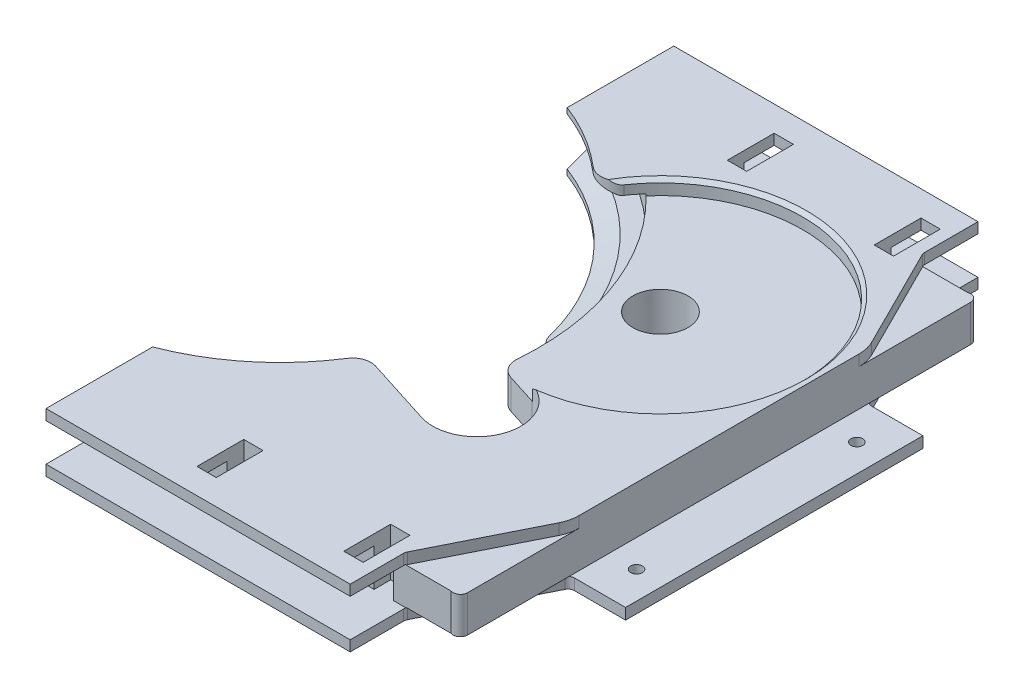
from build123d import *
from build123d.topology import SkipClean

# Parameters (mm, degrees)
EXTRUDE_1_DEPTH         = 4.5
FILLET_START            = -5
FILLET_1_DEPTH          = 10
EXTRUDE_2_DEPTH         = 0.5
EXTRUDE_3_DEPTH         = 3
CHAMFER_1_SIZE          = 5
CHAMFER_1_SIZE_2        = 2
CHAMFER_2_SIZE          = 5
CHAMFER_2_SIZE_2        = 2
SKETCH_5_R              = 7.5
SKETCH_5_R_2            = 9.5
CUT_EXTRUDE_1_DEPTH     = 30
SKETCH_6_R              = 38.75
CUT_EXTRUDE_2_DEPTH     = 4
CHAMFER_3_SIZE          = 1
SKETCH_7_R              = 38.75
CUT_EXTRUDE_3_DEPTH     = 4
CHAMFER_4_SIZE          = 1
FILLET_5_R              = 5
CUT_EXTRUDE_START       = -3
SKETCH_9_W              = 5
SKETCH_9_H              = 12.5
CUT_EXTRUDE_4_DEPTH     = 3
SKETCH_10_W             = 5
SKETCH_10_H             = 4.522155871
CUT_EXTRUDE_5_DEPTH     = 10
CUT_EXTRUDE_6_DEPTH     = 3
FILLET_6_R              = 10
SKETCH_12_R             = 1.6
CUT_EXTRUDE_7_DEPTH     = 10
MOVE_START              = -5.125
MOVE_FACE_1_DEPTH       = 10.25
MOVE_START_2            = 31.473684174
MOVE_FACE_2_DEPTH       = 5.25
MOVE_START_3            = 71.473684174
MOVE_FACE_2_2_DEPTH     = 5.25
CUT_EXTRUDE_START_2     = -13
CUT_EXTRUDE_8_OUTLINE_R = 9.5
CUT_EXTRUDE_8_DEPTH     = 13
FILLET_8_R              = 5
FILLET_9_R              = 5


with BuildPart() as part:
    # ｽｹｯﾁ2 → ﾎﾞｽ - 押し出し1 (new, symmetric)
    with BuildSketch(Plane(origin=(0, 0, 0), x_dir=(1, 0, 0), z_dir=(0, 1, 0))):
        with BuildLine():
            Line((95.1, 70.5), (-24.5, 70.5))
            ThreePointArc((-24.5, 70.5), (25.351028074, 49.851028074), (46, 0))
            ThreePointArc((46, 0), (25.351028074, -49.851028074), (-24.5, -70.5))
            Line((-24.5, -70.5), (95.1, -70.5))
            Line((95.1, -70.5), (95.1, 70.5))
        make_face()
    extrude(amount=EXTRUDE_1_DEPTH, both=True)

    # ﾌｨﾚｯﾄ1: read off the stored shape, not the designer's step
    # ﾌｨﾚｯﾄ1 outline → ﾌｨﾚｯﾄ1 (cut)
    with BuildSketch(Plane(origin=(0, 0, 0), x_dir=(1, 0, 0), z_dir=(0, 1, 0)).offset(FILLET_START)):
        with BuildLine():
            Line((95.1, 70.5), (93.1, 70.5))
            ThreePointArc((93.1, 70.5), (94.514213562, 69.914213562), (95.1, 68.5))
            Line((95.1, 68.5), (95.1, 70.5))
        make_face()
        with BuildLine():
            ThreePointArc((-1.406451941, 66.610344828), (-2.723536699, 68.83218192), (-0.751315826, 70.5))
            Line((-0.751315826, 70.5), (-24.5, 70.5))
            ThreePointArc((-24.5, 70.5), (-12.790587341, 69.520785778), (-1.406451941, 66.610344828))
        make_face()
        with BuildLine():
            Line((95.1, -70.5), (95.1, -68.5))
            ThreePointArc((95.1, -68.5), (94.514213562, -69.914213562), (93.1, -70.5))
            Line((93.1, -70.5), (95.1, -70.5))
        make_face()
        with BuildLine():
            ThreePointArc((-0.751315826, -70.5), (-2.723536699, -68.83218192), (-1.406451941, -66.610344828))
            ThreePointArc((-1.406451941, -66.610344828), (-12.790587341, -69.520785778), (-24.5, -70.5))
            Line((-24.5, -70.5), (-0.751315826, -70.5))
        make_face()
    extrude(amount=FILLET_1_DEPTH, mode=Mode.SUBTRACT)

    # ｽｹｯﾁ3 → ﾎﾞｽ - 押し出し2 (add)
    with BuildSketch(Plane(origin=(0, 4.5, 0), x_dir=(1, 0, 0), z_dir=(0, 1, 0))):
        with BuildLine():
            Line((-2.751315826, -56.455688258), (-2.751315826, -68.5))
            ThreePointArc((-2.751315826, -68.5), (-2.165529388, -69.914213562), (-0.751315826, -70.5))
            Line((-0.751315826, -70.5), (93.1, -70.5))
            ThreePointArc((93.1, -70.5), (94.514213562, -69.914213562), (95.1, -68.5))
            Line((95.1, -68.5), (95.1, 68.5))
            ThreePointArc((95.1, 68.5), (94.514213562, 69.914213562), (93.1, 70.5))
            Line((93.1, 70.5), (-0.751315826, 70.5))
            ThreePointArc((-0.751315826, 70.5), (-2.165529388, 69.914213562), (-2.751315826, 68.5))
            Line((-2.751315826, 68.5), (-2.751315826, 56.455688258))
            ThreePointArc((-2.751315826, 56.455688258), (36, 0), (-2.751315826, -56.455688258))
        make_face()
    extrude_2 = extrude(amount=EXTRUDE_2_DEPTH)

    # ｽｹｯﾁ4 → ﾎﾞｽ - 押し出し3 (add)
    with BuildSketch(Plane(origin=(0, 5, 0), x_dir=(1, 0, 0), z_dir=(0, 1, 0))):
        with BuildLine():
            Line((80.1, 85.5), (-2.751315826, 85.5))
            Line((-2.751315826, 85.5), (-2.751315826, 56.455688258))
            ThreePointArc((-2.751315826, 56.455688258), (36, 0), (-2.751315826, -56.455688258))
            Line((-2.751315826, -56.455688258), (-2.751315826, -85.5))
            Line((-2.751315826, -85.5), (80.1, -85.5))
            Line((80.1, -85.5), (80.1, -70.913118961))
            ThreePointArc((80.1, -70.913118961), (80.146814268, -70.51105135), (80.284752416, -70.130495168))
            Line((80.284752416, -70.130495168), (94.616311896, -41.467376208))
            ThreePointArc((94.616311896, -41.467376208), (95.261530034, -40.761361085), (96.18155948, -40.5))
            Line((96.18155948, -40.5), (110.1, -40.5))
            Line((110.1, -40.5), (110.1, 40.5))
            Line((110.1, 40.5), (96.18155948, 40.5))
            ThreePointArc((96.18155948, 40.5), (95.261530034, 40.761361085), (94.616311896, 41.467376208))
            Line((94.616311896, 41.467376208), (80.284752416, 70.130495168))
            ThreePointArc((80.284752416, 70.130495168), (80.146814268, 70.51105135), (80.1, 70.913118961))
            Line((80.1, 70.913118961), (80.1, 85.5))
        make_face()
    extrude_3 = extrude(amount=EXTRUDE_3_DEPTH)

    # ﾐﾗｰ1: ﾎﾞｽ - 押し出し2, ﾎﾞｽ - 押し出し3 across plane
    add(extrude_2.mirror(Plane.ZX))
    add(extrude_3.mirror(Plane.ZX))

    # 面取り1
    # the kernel refuses this chamfer: 5, 2 mm, written as the material it takes off along each edge
    with BuildSketch(Plane(origin=(-24.5, 4.5, 0), x_dir=(0.15260552545264225, 0, -0.9882871817449232), z_dir=(-0.9882871817449232, 0, -0.15260552545264225))) as chamfer_1_piece_1:
        Polygon((60.5 + CHAMFER_1_SIZE, 0), (60.5, -CHAMFER_1_SIZE_2), (60.5, 0), align=None)
    revolve(axis=Axis((-24.5, 4.5, 0), (0, -1, 0)), revolution_arc=162.444098221, mode=Mode.SUBTRACT)

    # 面取り2
    # the kernel refuses this chamfer: 5, 2 mm, written as the material it takes off along each edge
    with BuildSketch(Plane(origin=(-24.5, -4.5, 0), x_dir=(0.15260552545264225, 0, -0.9882871817449232), z_dir=(-0.9882871817449232, 0, -0.15260552545264225))) as chamfer_2_piece_1:
        Polygon((60.5 + CHAMFER_2_SIZE, 0), (60.5, CHAMFER_2_SIZE_2), (60.5, 0), align=None)
    revolve(axis=Axis((-24.5, -4.5, 0), (0, -1, 0)), revolution_arc=162.444098221, mode=Mode.SUBTRACT)

    # ｽｹｯﾁ5 → ｶｯﾄ - 押し出し1 (cut)
    with BuildSketch(Plane(origin=(0, 8, 0), x_dir=(1, 0, 0), z_dir=(0, 1, 0))):
        with Locations(Location((54.1, 25, 0), (0, 0, 270))):
            Circle(SKETCH_5_R)
        with Locations(Location((54.1, -25, 0), (0, 0, 270))):
            Circle(SKETCH_5_R_2)
    extrude(amount=-CUT_EXTRUDE_1_DEPTH, mode=Mode.SUBTRACT)

    # ｽｹｯﾁ6 → ｶｯﾄ - 押し出し2 (cut)
    with BuildSketch(Plane(origin=(0, 8, 0), x_dir=(1, 0, 0), z_dir=(0, 1, 0))):
        with Locations((54.1, 25)):
            Circle(SKETCH_6_R)
    extrude(amount=-CUT_EXTRUDE_2_DEPTH, mode=Mode.SUBTRACT)

    # 面取り3
    chamfer_3_edges = [part.edges().sort_by_distance(p)[0] for p in [
        (62.737010908, 8, -62.775184216),
    ]]
    chamfer(chamfer_3_edges, length=CHAMFER_3_SIZE)

    # ｽｹｯﾁ7 → ｶｯﾄ - 押し出し3 (cut)
    with BuildSketch(Plane.XZ.offset(8)):
        with Locations((54.1, 25)):
            Circle(SKETCH_7_R)
    extrude(amount=-CUT_EXTRUDE_3_DEPTH, mode=Mode.SUBTRACT)

    # 面取り4
    chamfer_4_edges = [part.edges().sort_by_distance(p)[0] for p in [
        (62.737010908, -8, 62.775184216),
    ]]
    chamfer(chamfer_4_edges, length=CHAMFER_4_SIZE)

    # ﾌｨﾚｯﾄ5
    # the kernel refuses this fillet: 5 mm, written as the material it takes off along each edge
    with BuildSketch(Plane(origin=(35.340814026, 22.117083115, 8.906569299), x_dir=(-0.19646141095302042, 0, 0.9805115573038129), z_dir=(0, -1, 0))) as fillet_5_piece_1:
        with BuildLine():
            CenterArc((6.296702388, -4.993752638), FILLET_5_R, 92.864482588, 95.995664977)
            ThreePointArc((1.356366206, -5.763868475), (0.788439893, -2.855988367), (0, 0))
            ThreePointArc((0, 0), (3.023416623, -0.075593078), (6.046833246, 0))
        make_face()
    extrude(amount=30.734166229, mode=Mode.SUBTRACT)
    with BuildSketch(Plane(origin=(19.200217157, 22.117083115, -41.839467258), x_dir=(-0.72679433316816, 0, -0.6868551501405878), z_dir=(0, -1, 0))) as fillet_5_piece_2_section:
        with BuildLine():
            CenterArc((6.296702388, 4.993752638), FILLET_5_R, 171.139852436, 95.995664977)
            ThreePointArc((1.356366206, 5.763868475), (0.788439893, 2.855988367), (0, 0))
            ThreePointArc((0, 0), (3.023416623, 0.075593078), (6.046833246, 0))
        make_face()
    fillet_5_piece_2 = extrude(amount=30.734166229, mode=Mode.PRIVATE)
    fillet_5_piece_2 = split(fillet_5_piece_2, bisect_by=Plane(origin=(19.200217157, -4.5, -41.839467258), z_dir=(0, 1, 0)), keep=Keep.TOP, mode=Mode.PRIVATE)
    add(fillet_5_piece_2, mode=Mode.SUBTRACT)
    with BuildSketch(Plane(origin=(19.200217157, -22.117083115, 41.839467258), x_dir=(0.5021090947020985, 0, 0.8648042882741962), z_dir=(0, 1, 0))) as fillet_5_piece_3_section:
        with BuildLine():
            CenterArc((6.303329727, -4.985384713), FILLET_5_R, 94.381896893, 95.995664977)
            ThreePointArc((1.385119276, -5.886054442), (0.766142777, -2.925711475), (0, 0))
            ThreePointArc((0, 0), (2.960654872, -0.113268478), (5.921309743, 0))
        make_face()
    fillet_5_piece_3 = extrude(amount=30.734166229, mode=Mode.PRIVATE)
    fillet_5_piece_3 = split(fillet_5_piece_3, bisect_by=Plane(origin=(19.200217157, -4.5, 41.839467258), z_dir=(0, -1, 0)), keep=Keep.TOP, mode=Mode.PRIVATE)
    add(fillet_5_piece_3, mode=Mode.SUBTRACT)
    with BuildSketch(Plane(origin=(35.340814026, -22.117083115, -8.906569299), x_dir=(0.9094383285267518, 0, -0.41583882287067403), z_dir=(0, 1, 0))) as fillet_5_piece_4:
        with BuildLine():
            CenterArc((6.303329727, 4.985384713), FILLET_5_R, 169.62243813, 95.995664977)
            ThreePointArc((1.385119276, 5.886054442), (0.766142777, 2.925711475), (0, 0))
            ThreePointArc((0, 0), (2.960654872, 0.113268478), (5.921309743, 0))
        make_face()
    extrude(amount=30.734166229, mode=Mode.SUBTRACT)

    # ｽｹｯﾁ9 → ｶｯﾄ - 押し出し4 (cut)
    with BuildSketch(Plane(origin=(0, 8, 0), x_dir=(1, 0, 0), z_dir=(0, 1, 0)).offset(CUT_EXTRUDE_START)):
        with Locations((34.098684174, 72.227844129)):
            Rectangle(SKETCH_9_W, SKETCH_9_H)
        with Locations((74.098684174, 72.227844129)):
            Rectangle(SKETCH_9_W, SKETCH_9_H)
    cut_extrude_4 = extrude(amount=CUT_EXTRUDE_4_DEPTH, mode=Mode.SUBTRACT)

    # ｽｹｯﾁ10 → ｶｯﾄ - 押し出し5 (cut)
    with BuildSketch(Plane(origin=(0, 5, 0), x_dir=(1, 0, 0), z_dir=(0, 1, 0))):
        with Locations((34.098684174, 68.238922065)):
            Rectangle(SKETCH_10_W, SKETCH_10_H)
        with Locations((74.098684174, 68.238922065)):
            Rectangle(SKETCH_10_W, SKETCH_10_H)
    cut_extrude_5 = extrude(amount=-CUT_EXTRUDE_5_DEPTH, mode=Mode.SUBTRACT)

    # ﾐﾗｰ2: ｶｯﾄ - 押し出し4, ｶｯﾄ - 押し出し5 across plane
    add(cut_extrude_4.mirror(Plane.XY), mode=Mode.SUBTRACT)
    add(cut_extrude_5.mirror(Plane.XY), mode=Mode.SUBTRACT)

    # ｽｹｯﾁ11 → ｶｯﾄ - 押し出し6 (cut)
    with BuildSketch(Plane(origin=(0, 8, 0), x_dir=(1, 0, 0), z_dir=(0, 1, 0))):
        with BuildLine():
            Line((95.1, 40.5), (95.1, -40.5))
            Line((95.1, -40.5), (95.1, -40.874235089))
            ThreePointArc((95.1, -40.874235089), (95.609322027, -40.596203067), (96.18155948, -40.5))
            Line((96.18155948, -40.5), (110.1, -40.5))
            Line((110.1, -40.5), (110.1, 40.5))
            Line((110.1, 40.5), (96.18155948, 40.5))
            ThreePointArc((96.18155948, 40.5), (95.609322027, 40.596203067), (95.1, 40.874235089))
            Line((95.1, 40.874235089), (95.1, 40.5))
        make_face()
    extrude(amount=-CUT_EXTRUDE_6_DEPTH, mode=Mode.SUBTRACT)

    # ﾌｨﾚｯﾄ6
    # the kernel refuses this fillet: 10 mm, written as the material it takes off along each edge
    with BuildSketch(Plane(origin=(95.1, 14.83728716, -40.874235089), x_dir=(-0.5193327403679237, 0, -0.8545721179525709), z_dir=(0, -1, 0))) as fillet_6_piece_1:
        with BuildLine():
            CenterArc((2.856145416, -9.96605201), FILLET_6_R, 94.7224525, 26.565051177)
            Line((-2.337181988, -1.420330831), (-2.856514728, -0.565758713))
            Line((-2.856514728, -0.565758713), (-0.51933274, 0.854572118))
            Line((-0.51933274, 0.854572118), (0.350857763, 0.936428764))
            ThreePointArc((0.350857763, 0.936428764), (0.675747876, 0.891296436), (1.950525815, 0.996605201))
            Line((1.950525815, 0.996605201), (2.032854869, 0))
        make_face()
    extrude(amount=9.83728716, mode=Mode.SUBTRACT)
    with BuildSketch(Plane(origin=(95.1, 14.83728716, 40.874235089), x_dir=(0, 0, -1), z_dir=(0, -1, 0))) as fillet_6_piece_2:
        with BuildLine():
            CenterArc((2.734914864, -10), FILLET_6_R, 90, 26.565051177)
            Line((-1.737221091, -1.05572809), (-2.184434687, -0.161300899))
            ThreePointArc((-2.184434687, -0.161300899), (-1.040354714, 0.410739087), (-0.786151378, 0.618033989))
            Line((-0.786151378, 0.618033989), (0, 1))
            Line((0, 1), (2.734914864, 1))
            Line((2.734914864, 1), (2.734914864, 0))
        make_face()
    extrude(amount=9.83728716, mode=Mode.SUBTRACT)

    # ｽｹｯﾁ12 → ｶｯﾄ - 押し出し7 (cut)
    with BuildSketch(Plane.XZ.offset(8)):
        with Locations(Location((102.6, 30, 0), (0, 0, 270))):
            Circle(SKETCH_12_R)
        with Locations(Location((102.6, -30, 0), (0, 0, 270))):
            Circle(SKETCH_12_R)
    extrude(amount=-CUT_EXTRUDE_7_DEPTH, mode=Mode.SUBTRACT)

    # Move Face 1: read off the stored shape, not the designer's step
    # Move Face 1 outline → Move Face 1 (cut)
    with SkipClean():  # the faces are left unmerged after this step: merging them gives an invalid solid
        with BuildSketch(Plane(origin=(0, 0, 0), x_dir=(1, 0, 0), z_dir=(0, 1, 0)).offset(MOVE_START)):
            with BuildLine():
                Line((71.598684174, -70.375), (36.598684174, -70.375))
                Line((36.598684174, -70.375), (36.598684174, -65.977844129))
                Line((36.598684174, -65.977844129), (31.598684174, -65.977844129))
                Line((31.598684174, -65.977844129), (31.598684174, -70.375))
                Line((31.598684174, -70.375), (-0.055345281, -70.375))
                ThreePointArc((-0.055345281, -70.375), (-1.893256917, -70.141941091), (-2.751315826, -68.5))
                Line((-2.751315826, -68.5), (-2.751315826, -85.5))
                Line((-2.751315826, -85.5), (80.1, -85.5))
                Line((80.1, -85.5), (80.1, -70.913118961))
                ThreePointArc((80.1, -70.913118961), (80.112409259, -70.705084306), (80.149461048, -70.5))
                Line((80.149461048, -70.5), (93.1, -70.5))
                ThreePointArc((93.1, -70.5), (92.74644661, -70.468501969), (92.404029455, -70.375))
                Line((92.404029455, -70.375), (76.598684174, -70.375))
                Line((76.598684174, -70.375), (76.598684174, -65.977844129))
                Line((76.598684174, -65.977844129), (71.598684174, -65.977844129))
                Line((71.598684174, -65.977844129), (71.598684174, -70.375))
            make_face()
            with BuildLine():
                Line((36.598684174, 70.375), (71.598684174, 70.375))
                Line((71.598684174, 70.375), (71.598684174, 65.977844129))
                Line((71.598684174, 65.977844129), (76.598684174, 65.977844129))
                Line((76.598684174, 65.977844129), (76.598684174, 70.375))
                Line((76.598684174, 70.375), (92.404029455, 70.375))
                ThreePointArc((92.404029455, 70.375), (92.74644661, 70.468501969), (93.1, 70.5))
                Line((93.1, 70.5), (80.149461048, 70.5))
                ThreePointArc((80.149461048, 70.5), (80.112409259, 70.705084306), (80.1, 70.913118961))
                Line((80.1, 70.913118961), (80.1, 85.5))
                Line((80.1, 85.5), (-2.751315826, 85.5))
                Line((-2.751315826, 85.5), (-2.751315826, 68.500000008))
                ThreePointArc((-2.751315826, 68.500000008), (-1.893256914, 70.141941093), (-0.055345281, 70.375))
                Line((-0.055345281, 70.375), (31.598684174, 70.375))
                Line((31.598684174, 70.375), (31.598684174, 65.977844129))
                Line((31.598684174, 65.977844129), (36.598684174, 65.977844129))
                Line((36.598684174, 65.977844129), (36.598684174, 70.375))
            make_face()
        extrude(amount=MOVE_FACE_1_DEPTH, mode=Mode.SUBTRACT)

    # Move Face 2: read off the stored shape, not the designer's step
    # Move Face 2 outline → Move Face 2 (cut)
    with SkipClean():  # the faces are left unmerged after this step: merging them gives an invalid solid
        with BuildSketch(Plane.YZ.offset(MOVE_START_2)):
            Polygon((8, -65.852844129), (-5.125, -65.852844129), (-5.125, -70.375), (5.125, -70.375), (5.125, -78.602844129), (8, -78.602844129), align=None)
            Polygon((-5.125, 65.852844129), (8, 65.852844129), (8, 78.602844129), (5.125, 78.602844129), (5.125, 70.375), (-5.125, 70.375), align=None)
        extrude(amount=MOVE_FACE_2_DEPTH, mode=Mode.SUBTRACT)

    # Move Face 2 2 outline → Move Face 2 2 (cut)
    with SkipClean():  # the faces are left unmerged after this step: merging them gives an invalid solid
        with BuildSketch(Plane.YZ.offset(MOVE_START_3)):
            Polygon((8, -65.852844129), (-5.125, -65.852844129), (-5.125, -70.375), (5.125, -70.375), (5.125, -78.602844129), (8, -78.602844129), align=None)
            Polygon((-5.125, 65.852844129), (8, 65.852844129), (8, 78.602844129), (5.125, 78.602844129), (5.125, 70.375), (-5.125, 70.375), align=None)
        extrude(amount=MOVE_FACE_2_2_DEPTH, mode=Mode.SUBTRACT)

    # ｶｯﾄ - 押し出し8: read off the stored shape, not the designer's step
    # ｶｯﾄ - 押し出し8 outline → ｶｯﾄ - 押し出し8 (cut)
    with SkipClean():  # the faces are left unmerged after this step: merging them gives an invalid solid
        with BuildSketch(Plane(origin=(0, 8, 0), x_dir=(1, 0, 0), z_dir=(0, 1, 0)).offset(CUT_EXTRUDE_START_2)):
            with BuildLine():
                ThreePointArc((34.152844635, -14.835559181), (31.736106848, -22.310317939), (28.371215625, -29.408919707))
                Line((28.371215625, -29.408919707), (50.462757174, -36.435491446))
                ThreePointArc((50.462757174, -36.435491446), (65.535491446, -28.637242826), (57.737242826, -13.564508554))
                Line((57.737242826, -13.564508554), (45.340368533, -9.621482379))
                ThreePointArc((45.340368533, -9.621482379), (45.116001345, -11.129346643), (44.859083026, -12.632007035))
                ThreePointArc((44.859083026, -12.632007035), (42.774857782, -12.058111848), (40.725880062, -11.368879772))
                ThreePointArc((40.725880062, -11.368879772), (36.667669076, -11.639042003), (34.152844635, -14.835559181))
            make_face()
            with Locations((54.1, -25)):
                Circle(CUT_EXTRUDE_8_OUTLINE_R, mode=Mode.SUBTRACT)
        extrude(amount=CUT_EXTRUDE_8_DEPTH, mode=Mode.SUBTRACT)

    # ﾌｨﾚｯﾄ8
    fillet_8_edges = [part.edges().sort_by_distance(p)[0] for p in [
        (38.06588288, 0.25, 32.492465271),
        (45.340368533, 0, 9.621482379),
    ]]
    fillet(fillet_8_edges, radius=FILLET_8_R)

    # ﾌｨﾚｯﾄ9
    fillet_9_edges = [part.edges().sort_by_distance(p)[0] for p in [
        (28.371215625, 7.25, 29.408919707),
    ]]
    fillet(fillet_9_edges, radius=FILLET_9_R)


solid = part.part
